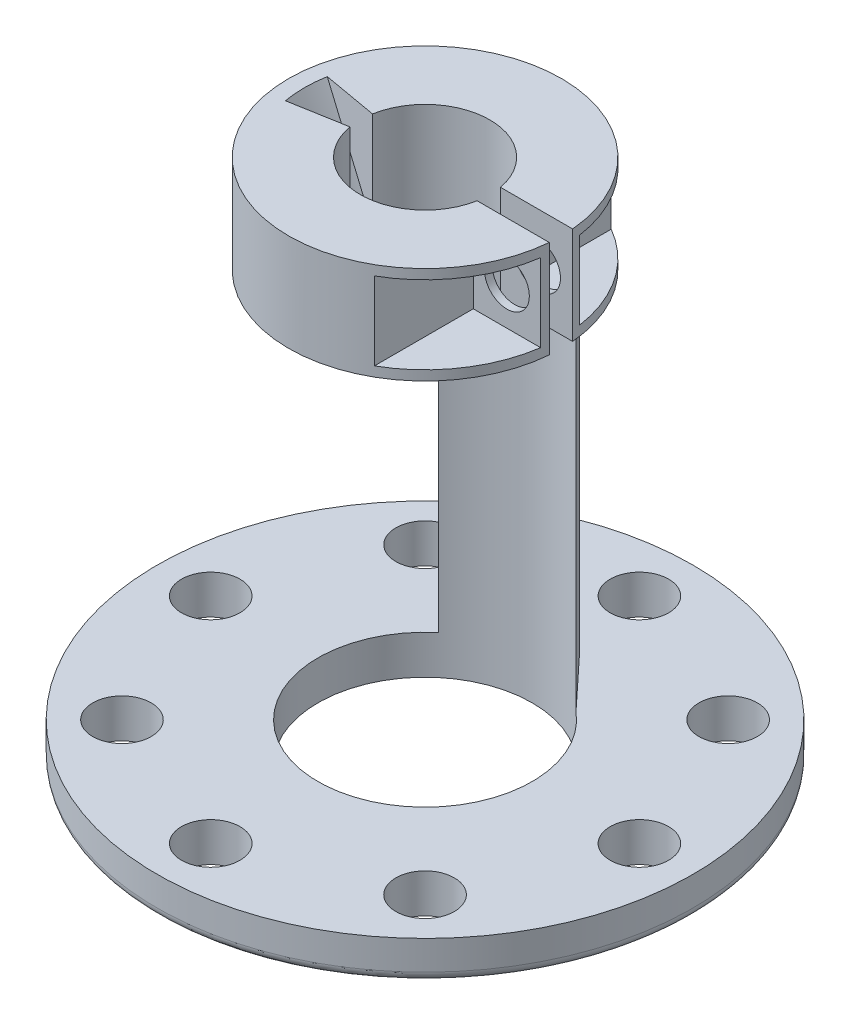
from build123d import *

# Parameters (mm, degrees)
ESQUISSE1_W                             = 8.25
ESQUISSE1_H                             = 2
CONG_1_R                                = 0.5
ESQUISSE8_R                             = 1.5
ENL_V_MAT_EXTRU_2_DEPTH                 = 20.548017883
R_P_TITION_CIRCULAIRE2_COUNT            = 8
BOSS_EXTRU_1_START                      = 20
BOSS_EXTRU_1_DEPTH                      = 20
BOSS_EXTRU_2_START                      = 5
ESQUISSE11_R                            = 7
ESQUISSE11_R_2                          = 3.325
BOSS_EXTRU_2_DEPTH                      = 5
ENL_V_MAT_EXTRU_3_REACH                 = 35.273
ESQUISSE12_W                            = 5
ESQUISSE12_H                            = 1.2
ESQUISSE14_W                            = 3.5
ESQUISSE14_H                            = 4
ENL_V_MAT_EXTRU_5_DEPTH                 = 6
ESQUISSE16_R                            = 1.15
ENL_V_MAT_EXTRU_6_DEPTH                 = 6
ENL_VEMENT_DE_MATI_RE_R_VOLUTION1_ANGLE = 20


with BuildPart() as part:
    # Esquisse1 → Révolution2 (revolve)
    with BuildSketch(Plane.XY):
        with Locations((9.625, 1)):
            Rectangle(ESQUISSE1_W, ESQUISSE1_H)
    revolve(axis=Axis((0, 0, 0), (0, 1, 0)))

    # Congé1
    cong_1_edges = [part.edges().sort_by_distance(p)[0] for p in [
        (-13.75, 0, 0),
    ]]
    fillet(cong_1_edges, radius=CONG_1_R)

    # Esquisse8 → Enlèv. mat.-Extru.2 (cut, through all)
    with BuildSketch(Plane(origin=(0, 2, 0), x_dir=(1, 0, 0), z_dir=(0, 1, 0))):
        with Locations((11, 0)):
            Circle(ESQUISSE8_R)
    enl_v_mat_extru_2 = extrude(amount=-ENL_V_MAT_EXTRU_2_DEPTH, mode=Mode.SUBTRACT)

    # Répétition circulaire2: Enlèv. mat.-Extru.2 ×8 about axis
    r_p_tition_circulaire2_axis = Axis((0, 0, 0), (0, -1, 0))
    for i in range(1, R_P_TITION_CIRCULAIRE2_COUNT):
        add(enl_v_mat_extru_2.rotate(r_p_tition_circulaire2_axis, i * 360 / R_P_TITION_CIRCULAIRE2_COUNT), mode=Mode.SUBTRACT)

    # Esquisse9 → Boss.-Extru.1 (add)
    with BuildSketch(Plane(origin=(0, 2, 0), x_dir=(1, 0, 0), z_dir=(0, 1, 0)).offset(BOSS_EXTRU_1_START)):
        with BuildLine():
            Line((-3.522211222, 4.224219231), (-1, 6.92820323))
            ThreePointArc((-1, 6.92820323), (0, 7), (1, 6.92820323))
            Line((1, 6.92820323), (3.522211222, 4.224219231))
            ThreePointArc((3.522211222, 4.224219231), (0, 5.5), (-3.522211222, 4.224219231))
        make_face()
    extrude(amount=-BOSS_EXTRU_1_DEPTH)

    # Esquisse11 → Boss.-Extru.2 (add)
    with BuildSketch(Plane(origin=(0, 22, 0), x_dir=(1, 0, 0), z_dir=(0, 1, 0)).offset(BOSS_EXTRU_2_START)):
        Circle(ESQUISSE11_R)
        Circle(ESQUISSE11_R_2, mode=Mode.SUBTRACT)
    extrude(amount=-BOSS_EXTRU_2_DEPTH)

    # Esquisse12 → Enlèv. mat.-Extru.3 (cut, up to next)
    with BuildSketch(Plane(origin=(0, 27, 0), x_dir=(1, 0, 0), z_dir=(0, 1, 0)), mode=Mode.PRIVATE) as enl_v_mat_extru_3_sk1:
        with Locations((5.425456655, 0)):
            Rectangle(ESQUISSE12_W, ESQUISSE12_H)
    enl_v_mat_extru_3_tool1 = extrude(enl_v_mat_extru_3_sk1.sketch, amount=-ENL_V_MAT_EXTRU_3_REACH, mode=Mode.PRIVATE) & part.part
    add(enl_v_mat_extru_3_tool1.solids().sort_by_distance((5.425457, 27, 0))[0], mode=Mode.SUBTRACT)

    # Esquisse14 → Enlèv. mat.-Extru.5 (cut)
    with BuildSketch(Plane(origin=(0, 27, 7), x_dir=(1, 0, 0), z_dir=(0, 0, 1))):
        with Locations((5.22423831, -2.5)):
            Rectangle(ESQUISSE14_W, ESQUISSE14_H)
    enl_v_mat_extru_5 = extrude(amount=-ENL_V_MAT_EXTRU_5_DEPTH, mode=Mode.SUBTRACT)

    # Esquisse16 → Enlèv. mat.-Extru.6 (cut)
    with BuildSketch(Plane.XY.offset(1)):
        with Locations((5.20122077, 24.5)):
            Circle(ESQUISSE16_R)
    extrude(amount=-ENL_V_MAT_EXTRU_6_DEPTH, mode=Mode.SUBTRACT)

    # Symétrie1: Enlèv. mat.-Extru.5 across plane
    add(enl_v_mat_extru_5.mirror(Plane.XY), mode=Mode.SUBTRACT)

    # Esquisse17 → Enlèvement de matière-Révolution1 (revolve, symmetric, cut)
    with BuildSketch(Plane.XY) as enl_vement_de_mati_re_r_volution1_sk:
        Polygon((-6.187811668, 27), (-3.325, 22), (-3.325, 27), align=None)
    revolve(axis=Axis((0, 0, 0), (0, 1, 0)), revolution_arc=ENL_VEMENT_DE_MATI_RE_R_VOLUTION1_ANGLE / 2, mode=Mode.SUBTRACT)
    revolve(enl_vement_de_mati_re_r_volution1_sk.sketch, axis=Axis((0, 0, 0), (0, -1, 0)), revolution_arc=ENL_VEMENT_DE_MATI_RE_R_VOLUTION1_ANGLE / 2, mode=Mode.SUBTRACT)


solid = part.part
